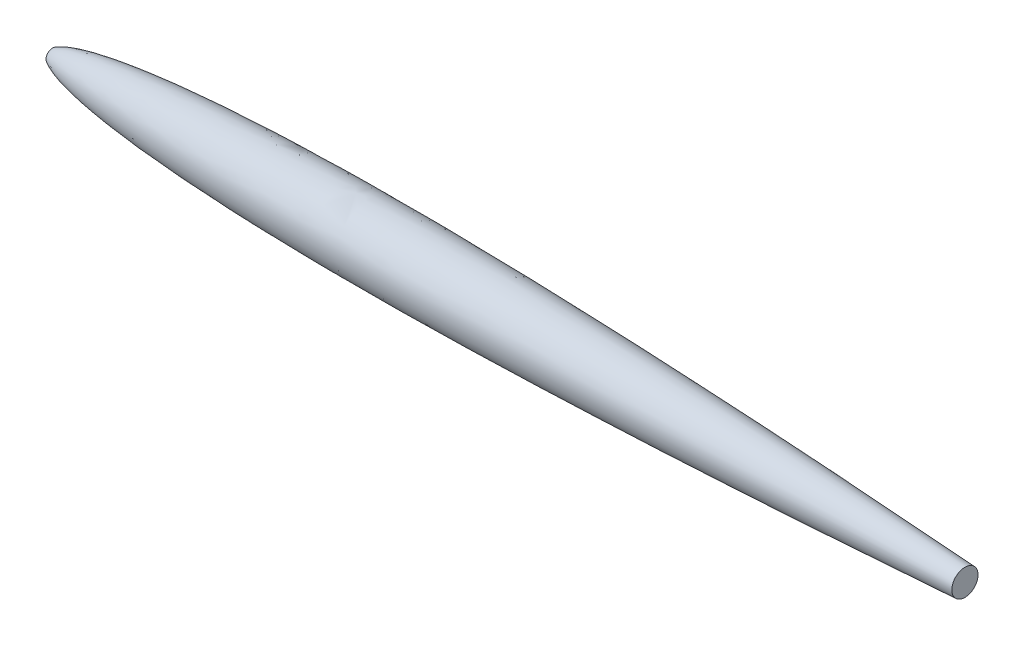
from build123d import *

# Parameters (mm, degrees)
CUTSKETCH_R        = 330
CUT_EXTRUDE1_DEPTH = 9033.067959266
SKETCH1_R          = 330
CUT_EXTRUDE2_DEPTH = 50


with BuildPart() as part:
    # rootSketch → Revolve1 (revolve)
    with BuildSketch(Plane(origin=(0, 0, 0), x_dir=(1, 0, 0), z_dir=(0, 1, 0))):
        with BuildLine():
            Line((0, 0), (10999.999999956, 0))
            add(Edge.make_bspline(
                [(0, 0), (0.000193085, 1.416582005), (0.122535707, 4.240766735), (0.673873379, 8.454686711), (2.109656818, 13.93845879), (4.130019916, 19.114733958), (6.6108994, 23.964322659), (9.99141312, 29.368131534), (13.807367772, 34.371487293), (18.005055091, 39.082436475), (24.006567174, 45.012475537), (32.38394762, 52.235407337), (43.384048479, 60.194382801), (57.076069362, 68.618071155), (73.982979094, 77.724284629), (92.789267205, 86.643497962), (113.957785626, 95.516746756), (137.455558775, 104.311070441), (166.299503437, 114.136034239), (201.291019257, 124.83380424), (243.070199966, 136.204737597), (291.673004407, 147.963968929), (341.243287097, 158.777969553), (390.608018364, 168.603047356), (439.719156269, 177.608967602), (500.651651233, 187.980684512), (573.469223954, 199.282575084), (658.612232457, 211.186619601), (758.084154261, 223.607887379), (859.684753543, 234.995657417), (963.386980877, 245.464526813), (1069.170635517, 255.102838422), (1175.032596375, 263.835414151), (1280.957756037, 271.761542521), (1386.934581972, 278.961621427), (1492.954015963, 285.502236936), (1625.576964573, 292.926255548), (1784.827209806, 300.723903315), (1970.72108882, 308.376208714), (2183.266072594, 315.387382688), (2395.855799019, 320.860371187), (2608.476211675, 324.955727138), (2821.116716449, 327.806853247), (3033.769186051, 329.526860496), (3299.591922937, 330.384071895), (3618.580812409, 329.51376865), (3990.720403141, 326.052290468), (4415.985201528, 319.209100208), (4841.201558049, 309.857365651), (5266.363404579, 298.307410519), (5691.467689334, 284.815055747), (6116.513213618, 269.590680129), (6541.499783516, 252.805736724), (6966.427609798, 234.597307498), (7391.296846876, 215.071528971), (7816.107239786, 194.306117476), (8187.764015612, 175.096544249), (8506.288418891, 157.904884619), (8771.698784382, 143.095088026), (8984.01062255, 130.95609045), (9196.305479291, 118.523403252), (9382.048027901, 107.38440154), (9541.24447253, 97.647382898), (9673.900203702, 89.404934778), (9780.020008578, 82.733097615), (9912.663326878, 74.294734048), (10032.03499694, 66.58027009), (10138.136351112, 59.627723881), (10230.971046534, 53.471278218), (10284.016761583, 49.932402374), (10337.064143493, 46.372127364), (10390.104279802, 42.790919783), (10443.152990441, 39.18744375), (10496.183419271, 35.563459924), (10549.240167305, 31.915530826), (10602.249493916, 28.248814521), (10655.332945198, 24.554271665), (10708.28973189, 20.846283715), (10761.453592237, 17.100380429), (10814.258157127, 13.357501973), (10861.039415372, 10.020132172), (10900.208423325, 7.212345677), (10934.336848159, 4.754530233), (10958.871036751, 2.983522743), (10981.803250473, 1.321442896), (10993.97273069, 0.438031797), (10999.999999956, 0)],
                knots=[0, 0, 0, 0, 0, 0.000464454, 0.000928907, 0.001393361, 0.001857814, 0.002287128, 0.002716441, 0.003486019, 0.003922473, 0.004358926, 0.005488094, 0.007117503, 0.008377929, 0.009638355, 0.011796648, 0.013954941, 0.015918589, 0.017882237, 0.021809533, 0.025977713, 0.030145893, 0.034314073, 0.038482253, 0.042518279, 0.046554305, 0.054626357, 0.062698409, 0.070770462, 0.079497478, 0.088224494, 0.09695151, 0.105678526, 0.114405542, 0.123132558, 0.131859574, 0.14058659, 0.158058513, 0.175530436, 0.193002359, 0.210474282, 0.227946206, 0.24541813, 0.262890054, 0.280361977, 0.315305825, 0.350249672, 0.38519352, 0.420137368, 0.455081215, 0.490025063, 0.524968911, 0.559912758, 0.594856606, 0.629800453, 0.664744301, 0.699688149, 0.717160073, 0.734631996, 0.75210392, 0.769575844, 0.787047768, 0.79578373, 0.804519691, 0.813255653, 0.821991615, 0.839463539, 0.84383152, 0.848199501, 0.852567482, 0.856935463, 0.861303444, 0.865671425, 0.870039406, 0.874407387, 0.878775368, 0.883143349, 0.88751133, 0.891879311, 0.896247292, 0.900615273, 0.902799263, 0.904983254, 0.907167244, 0.909351235, 0.909351235, 0.909351235, 0.909351235, 0.909351235], degree=4))
        make_face()
    revolve(axis=Axis((0, 0, 0), (1, 0, 0)))

    # cutSketch → Cut-Extrude1 (cut, through all)
    with BuildSketch(Plane(origin=(9020, 0, 0), x_dir=(0, 0, -1), z_dir=(1, 0, 0))):
        Circle(CUTSKETCH_R)
    extrude(amount=CUT_EXTRUDE1_DEPTH, mode=Mode.SUBTRACT)

    # Sketch1 → Cut-Extrude2 (cut)
    with BuildSketch(Plane(origin=(0, 0, 0), x_dir=(0, 0, -1), z_dir=(1, 0, 0))):
        Circle(SKETCH1_R)
    extrude(amount=CUT_EXTRUDE2_DEPTH, mode=Mode.SUBTRACT)


solid = part.part
